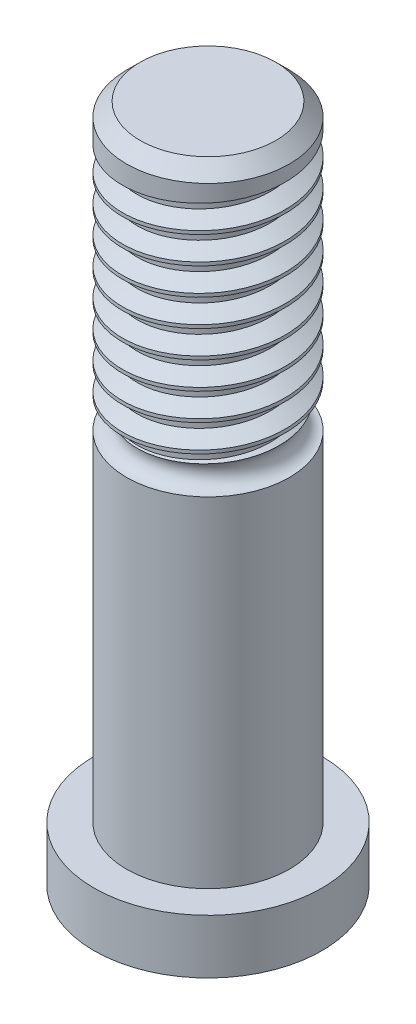
from build123d import *
from build123d.topology import SkipClean

# Parameters (mm, degrees)
CHAMFER1_SIZE = 0.5
THREAD1_PITCH = 1


with BuildPart() as part:
    # Sketch1 → Revolve1 (revolve)
    with BuildSketch(Plane(origin=(0, 0, 0), x_dir=(0, 0, -1), z_dir=(1, 0, 0)), mode=Mode.PRIVATE) as revolve1_sk:
        with BuildLine():
            Line((0, 12.5), (-3, 12.5))
            Line((-3, 12.5), (-3, 3))
            ThreePointArc((-3, 3), (-2.5, 2.5), (-3, 2))
            Line((-3, 2), (-3, -10.5))
            Line((-3, -10.5), (-4.2, -10.5))
            Line((-4.2, -10.5), (-4.2, -12.5))
            Line((-4.2, -12.5), (-3, -12.5))
            Line((-3, -12.5), (0, -12.5))
            Line((0, -12.5), (0, 12.5))
        make_face()
    revolve(revolve1_sk.sketch.rotate(Axis((0, -55, 0), (0, 1, 0)), 180), axis=Axis((0, -55, 0), (0, 1, 0)))

    # Chamfer1
    chamfer1_edges = [part.edges().sort_by_distance(p)[0] for p in [
        (0, 12.5, 3),
    ]]
    chamfer(chamfer1_edges, length=CHAMFER1_SIZE)

    # Thread1: the profile of Thread Profile1 profile screwed along a right-hand helix of 9 turns, 8 arcs to a turn; built about Z, then put on its axis
    with SkipClean():  # the faces are left unmerged after this step: merging them gives an invalid solid
        thread1_z = Axis((0, 0, 0), (0, 0, 1))
        thread1_corners = [(3.0003, 0, -0.000173205), (3.0003, 0, 0.875173202), (2.458734125, 0, 0.562499999), (2.458734125, 0, 0.312499999)]
        with BuildLine(mode=Mode.PRIVATE) as thread1_profile:
            Line(thread1_corners[0], thread1_corners[1])
            Line(thread1_corners[1], thread1_corners[2])
            Line(thread1_corners[2], thread1_corners[3])
            Line(thread1_corners[3], thread1_corners[0])
        thread1_cap = Face(thread1_profile.wire())
        thread1_turn_angles = [0, 22.5, 45, 67.5, 90, 112.5, 135, 157.5, 180, 202.5, 225, 247.5, 270, 292.5, 315, 337.5, 360]
        thread1_turn_weights = [1, 0.9238795325112867, 1, 0.9238795325112867, 1, 0.9238795325112867, 1, 0.9238795325112867, 1, 0.9238795325112867, 1, 0.9238795325112867, 1, 0.9238795325112867, 1, 0.9238795325112867, 1]
        thread1_turn_rails = [Edge.make_bspline([Vector(p[0], p[1], 0).rotate(thread1_z, thread1_turn_angles[k]) / thread1_turn_weights[k] + Vector(0, 0, p[2] + THREAD1_PITCH * thread1_turn_angles[k] / 360) for k in range(17)], [0, 0, 0, 1, 1, 2, 2, 3, 3, 4, 4, 5, 5, 6, 6, 7, 7, 8, 8, 8], 2, thread1_turn_weights) for p in thread1_corners]
        thread1_turn_sides = [Face.make_surface_from_curves(thread1_turn_rails[p[0]], thread1_turn_rails[p[1]]) for p in [(0, 1), (1, 2), (2, 3), (3, 0)]]
        thread1 = Plane(origin=(0, 12, 0), x_dir=(-1, 0, 0), z_dir=(0, -1, 0)) * Solid(Shell([*[p.moved(Location((0, 0, THREAD1_PITCH * i))) for i in range(9) for p in thread1_turn_sides], thread1_cap, thread1_cap.rotate(thread1_z, 3240).moved(Location((0, 0, THREAD1_PITCH * 3240 / 360)))]))
        add(thread1, mode=Mode.SUBTRACT)


solid = part.part
